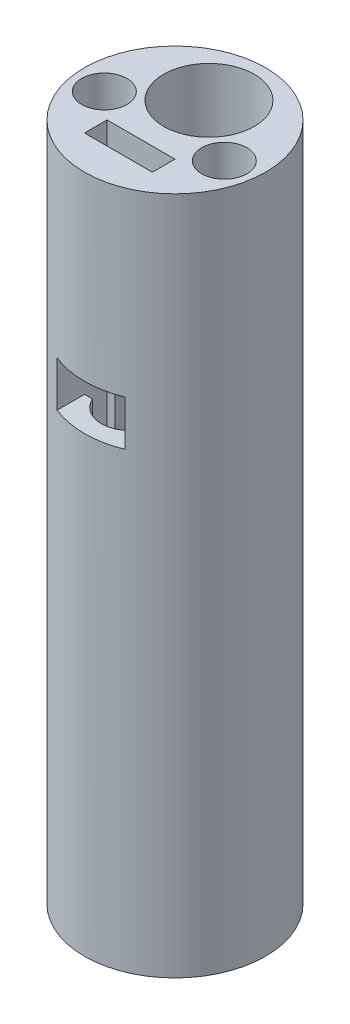
from build123d import *

# Parameters (mm, degrees)
SKETCH1_R           = 4
BOSS_EXTRUDE1_DEPTH = 30
SKETCH2_W           = 3
SKETCH2_H           = 1
CUT_EXTRUDE1_DEPTH  = 10
SKETCH3_R           = 2
CUT_EXTRUDE2_DEPTH  = 30
SKETCH4_W           = 3
SKETCH4_H           = 2
CUT_EXTRUDE3_DEPTH  = 30
SKETCH5_W           = 3
SKETCH5_H           = 2
CUT_EXTRUDE5_DEPTH  = 0.5
CUT_EXTRUDE7_START  = -3
CUT_EXTRUDE7_DEPTH  = 3
CUT_EXTRUDE8_START  = -3
SKETCH8_R           = 1.25
CUT_EXTRUDE8_DEPTH  = 3
SKETCH9_R           = 0.5
CUT_EXTRUDE9_DEPTH  = 13.5
SKETCH10_R          = 0.25
CUT_EXTRUDE10_DEPTH = 30
SKETCH11_R          = 1
CUT_EXTRUDE11_DEPTH = 30


# Read off the part's stored shape, not the designer's step: Cut-Extrude7
with BuildPart() as part:
    # Sketch1 → Boss-Extrude1 (new body)
    with BuildSketch(Plane(origin=(0, 0, 0), x_dir=(1, 0, 0), z_dir=(0, 1, 0))):
        with Locations(Location((0, 0, 0), (0, 0, 270))):
            Circle(SKETCH1_R)
    extrude(amount=BOSS_EXTRUDE1_DEPTH)

    # Sketch2 → Cut-Extrude1 (cut)
    with BuildSketch(Plane(origin=(0, 30, 0), x_dir=(1, 0, 0), z_dir=(0, 1, 0))):
        with Locations((0, -2)):
            Rectangle(SKETCH2_W, SKETCH2_H)
    extrude(amount=-CUT_EXTRUDE1_DEPTH, mode=Mode.SUBTRACT)

    # Sketch3 → Cut-Extrude2 (cut)
    with BuildSketch(Plane(origin=(0, 30, 0), x_dir=(1, 0, 0), z_dir=(0, 1, 0))):
        with Locations(Location((0, 1.5, 0), (0, 0, 270))):
            Circle(SKETCH3_R)
    extrude(amount=-CUT_EXTRUDE2_DEPTH, mode=Mode.SUBTRACT)

    # Sketch4 → Cut-Extrude3 (cut)
    with BuildSketch(Plane(origin=(0, 0, 2.5), x_dir=(-1, 0, 0), z_dir=(0, 0, -1))):
        with Locations((0, 21)):
            Rectangle(SKETCH4_W, SKETCH4_H)
    extrude(amount=-CUT_EXTRUDE3_DEPTH, mode=Mode.SUBTRACT)

    # Sketch5 → Cut-Extrude5 (cut)
    with BuildSketch(Plane.XY.offset(1.5)):
        with Locations((0, 21)):
            Rectangle(SKETCH5_W, SKETCH5_H)
    extrude(amount=-CUT_EXTRUDE5_DEPTH, mode=Mode.SUBTRACT)

    # Cut-Extrude7 outline → Cut-Extrude7 (cut)
    with BuildSketch(Plane(origin=(0, 20, 0), x_dir=(1, 0, 0), z_dir=(0, 1, 0)).offset(CUT_EXTRUDE7_START)):
        with BuildLine():
            Line((1.145643924, -2.5), (1.5, -2.5))
            Line((1.5, -2.5), (1.5, -1.5))
            Line((1.5, -1.5), (1.145643924, -1.5))
            ThreePointArc((1.145643924, -1.5), (0.980237967, -1.224349609), (0.75, -1))
            Line((0.75, -1), (-0.75, -1))
            ThreePointArc((-0.75, -1), (-0.980237967, -1.224349609), (-1.145643924, -1.5))
            Line((-1.145643924, -1.5), (-1.5, -1.5))
            Line((-1.5, -1.5), (-1.5, -2.5))
            Line((-1.5, -2.5), (-1.145643924, -2.5))
            ThreePointArc((-1.145643924, -2.5), (0, -3.25), (1.145643924, -2.5))
        make_face()
    extrude(amount=CUT_EXTRUDE7_DEPTH, mode=Mode.SUBTRACT)

    # Sketch8 → Cut-Extrude8 (cut)
    with BuildSketch(Plane(origin=(0, 17, 0), x_dir=(1, 0, 0), z_dir=(0, 1, 0)).offset(CUT_EXTRUDE8_START)):
        with Locations(Location((0, -2, 0), (0, 0, 270))):
            Circle(SKETCH8_R)
    extrude(amount=CUT_EXTRUDE8_DEPTH, mode=Mode.SUBTRACT)

    # Sketch9 → Cut-Extrude9 (cut)
    with BuildSketch(Plane(origin=(0, 14, 0), x_dir=(1, 0, 0), z_dir=(0, 1, 0))):
        with Locations(Location((0, -2, 0), (0, 0, 270))):
            Circle(SKETCH9_R)
    extrude(amount=-CUT_EXTRUDE9_DEPTH, mode=Mode.SUBTRACT)

    # Sketch10 → Cut-Extrude10 (cut)
    with BuildSketch(Plane(origin=(0, 0.5, 0), x_dir=(1, 0, 0), z_dir=(0, 1, 0))):
        with Locations(Location((0, -2, 0), (0, 0, 270))):
            Circle(SKETCH10_R)
    extrude(amount=-CUT_EXTRUDE10_DEPTH, mode=Mode.SUBTRACT)

    # Sketch11 → Cut-Extrude11 (cut)
    with BuildSketch(Plane(origin=(0, 30, 0), x_dir=(1, 0, 0), z_dir=(0, 1, 0))):
        with Locations(Location((-2.65, -0.472074699, 0), (0, 0, 270))):
            Circle(SKETCH11_R)
        with Locations(Location((2.65, -0.472074699, 0), (0, 0, 270))):
            Circle(SKETCH11_R)
    extrude(amount=-CUT_EXTRUDE11_DEPTH, mode=Mode.SUBTRACT)


solid = part.part
